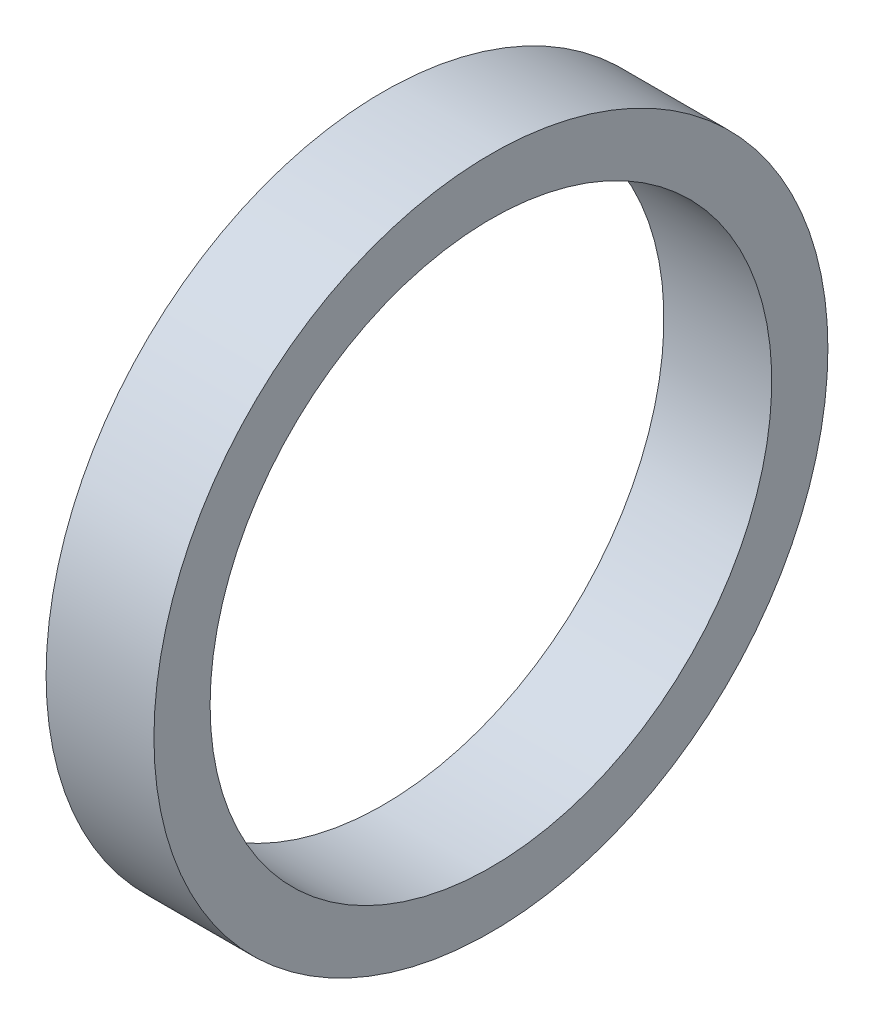
from build123d import *

# Parameters (mm, degrees)
SKETCH1_R           = 9.525
SKETCH1_R_2         = 7.9375
BOSS_EXTRUDE1_DEPTH = 3.048


with BuildPart() as part:
    # Sketch1 → Boss-Extrude1 (new body)
    with BuildSketch(Plane(origin=(0, 0, 0), x_dir=(0, 0, -1), z_dir=(1, 0, 0))):
        Circle(SKETCH1_R)
        Circle(SKETCH1_R_2, mode=Mode.SUBTRACT)
    extrude(amount=BOSS_EXTRUDE1_DEPTH)


solid = part.part
